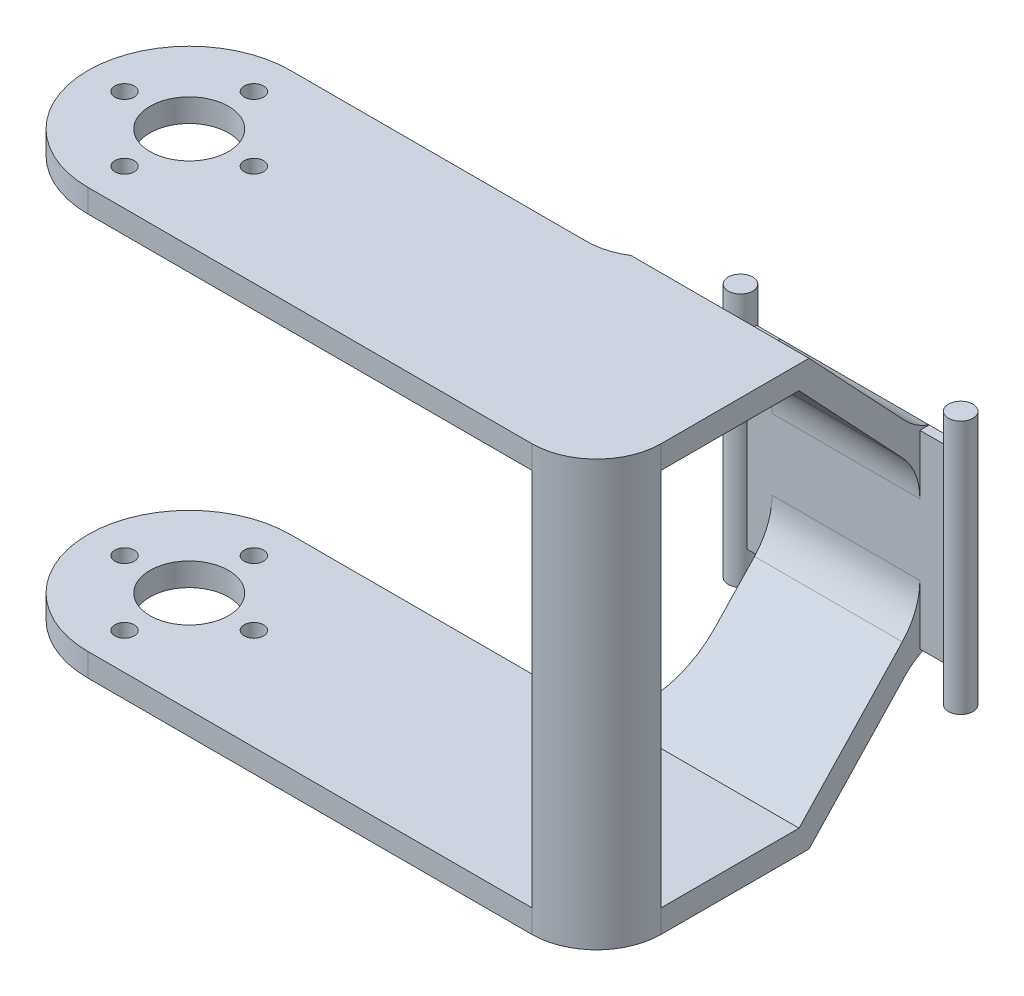
from build123d import *

# Parameters (mm, degrees)
SKETCH1_W           = 23.83
SKETCH1_H           = 1
BOSS_EXTRUDE1_DEPTH = 20.5
SKETCH2_R           = 1.325
BOSS_EXTRUDE2_DEPTH = 13.75
BOSS_EXTRUDE4_DEPTH = 8
SKETCH5_W           = 21.919818374
SKETCH5_H           = 2.5
BOSS_EXTRUDE5_DEPTH = 50
SKETCH6_R           = 4.25
SKETCH6_R_2         = 1.05
CUT_EXTRUDE1_DEPTH  = 83.099025573
FILLET1_R           = 7
FILLET2_R           = 7
FILLET3_R           = 7
BOSS_EXTRUDE6_START = 41
BOSS_EXTRUDE6_DEPTH = 41


with BuildPart() as part:
    # Sketch1 → Boss-Extrude1 (new body)
    with BuildSketch(Plane(origin=(0, 0, 0), x_dir=(1, 0, 0), z_dir=(0, 1, 0))):
        Rectangle(SKETCH1_W, SKETCH1_H)
    extrude(amount=BOSS_EXTRUDE1_DEPTH)

    # Sketch2 → Boss-Extrude2 (add, symmetric)
    with BuildSketch(Plane(origin=(0, 10.25, 0), x_dir=(1, 0, 0), z_dir=(0, 1, 0))):
        with Locations(Location((-11.915, 0, 0), (0, 0, 270))):
            Circle(SKETCH2_R)
        with Locations(Location((11.915, 0, 0), (0, 0, 270))):
            Circle(SKETCH2_R)
    extrude(amount=BOSS_EXTRUDE2_DEPTH, both=True)

    # Sketch4 → Boss-Extrude4 (add, symmetric)
    with BuildSketch(Plane(origin=(0, 0, 0), x_dir=(0, 0, -1), z_dir=(1, 0, 0))):
        Polygon((-0.5, 16.852307022), (-0.5, 20.5), (-12.5, 33.25), (-35.5, 33.25), (-35.5, 30.75), (-13.580181626, 30.75), align=None)
        Polygon((-0.5, 0), (-0.5, 3.647692978), (-13.580181626, -10.25), (-35.5, -10.25), (-35.5, -12.75), (-12.5, -12.75), align=None)
    extrude(amount=BOSS_EXTRUDE4_DEPTH, both=True)

    # Sketch5 → Boss-Extrude5 (add)
    with BuildSketch(Plane.ZY.offset(8)):
        with Locations((24.540090813, 32)):
            Rectangle(SKETCH5_W, SKETCH5_H)
        with Locations((24.540090813, -11.5)):
            Rectangle(SKETCH5_W, SKETCH5_H)
    extrude(amount=BOSS_EXTRUDE5_DEPTH)

    # Sketch6 → Cut-Extrude1 (cut, through all)
    with BuildSketch(Plane(origin=(0, 33.25, 0), x_dir=(1, 0, 0), z_dir=(0, 1, 0))):
        with Locations(Location((-47.040090813, -24.540090813, 0), (0, 0, 270))):
            Circle(SKETCH6_R)
        with Locations(Location((-54.040090813, -24.540090813, 0), (0, 0, 270))):
            Circle(SKETCH6_R_2)
        with Locations(Location((-47.040090813, -17.540090813, 0), (0, 0, 270))):
            Circle(SKETCH6_R_2)
        with Locations(Location((-40.040090813, -24.540090813, 0), (0, 0, 270))):
            Circle(SKETCH6_R_2)
        with Locations(Location((-47.040090813, -31.540090813, 0), (0, 0, 270))):
            Circle(SKETCH6_R_2)
        with BuildLine():
            ThreePointArc((-58, -24.540090813), (-54.78991692, -16.790264706), (-47.040090813, -13.580181626))
            Line((-47.040090813, -13.580181626), (-58, -13.580181626))
            Line((-58, -13.580181626), (-58, -24.540090813))
        make_face()
        with BuildLine():
            ThreePointArc((-47.040090813, -35.5), (-54.78991692, -32.28991692), (-58, -24.540090813))
            Line((-58, -24.540090813), (-58, -35.5))
            Line((-58, -35.5), (-47.040090813, -35.5))
        make_face()
    extrude(amount=-CUT_EXTRUDE1_DEPTH, mode=Mode.SUBTRACT)

    # Fillet1
    # the kernel refuses this fillet: 7 mm, written as the material it adds along each edge
    with BuildSketch(Plane(origin=(-8, -12.75, 13.580181626), x_dir=(-1, 0, 0), z_dir=(0, 1, 0))) as fillet1_piece_1_section:
        with BuildLine():
            CenterArc((FILLET1_R, -FILLET1_R), FILLET1_R, 90, 90)
            Line((0, -FILLET1_R), (0, 0))
            Line((0, 0), (FILLET1_R, 0))
        make_face()
    fillet1_piece_1 = extrude(amount=2.5, mode=Mode.PRIVATE)
    fillet1_piece_1 = split(fillet1_piece_1, bisect_by=Plane(origin=(-10.020174451, -12.153760937, 11.938833823), z_dir=(0, 0.6853646990049913, 0.7281999926928027)), keep=Keep.TOP, mode=Mode.PRIVATE)
    fillet1_piece_1 = split(fillet1_piece_1, bisect_by=Plane(origin=(-10.020174451, -10.440349189, 13.759333804), z_dir=(0, -0.685364699004991, -0.7281999926928029)), keep=Keep.TOP, mode=Mode.PRIVATE)
    add(fillet1_piece_1)
    with BuildSketch(Plane(origin=(-8, -12.75, 13.580181626), x_dir=(-1, 0, 0), z_dir=(0, 1, 0))) as fillet1_piece_2_section:
        with BuildLine():
            CenterArc((FILLET1_R, -FILLET1_R), FILLET1_R, 90, 90)
            Line((0, -FILLET1_R), (0, 0))
            Line((0, 0), (FILLET1_R, 0))
        make_face()
    fillet1_piece_2 = extrude(amount=20, mode=Mode.PRIVATE)
    fillet1_piece_2 = split(fillet1_piece_2, bisect_by=Plane(origin=(-8.816209607, -9.698679662, 9.628169093), z_dir=(0, 0.6853646990049913, 0.7281999926928027)), keep=Keep.TOP, mode=Mode.PRIVATE)
    fillet1_piece_2 = split(fillet1_piece_2, bisect_by=Plane(origin=(-8.816209607, -10.25, 10.809130305), z_dir=(0, 1, 0)), keep=Keep.TOP, mode=Mode.PRIVATE)
    fillet1_piece_2 = split(fillet1_piece_2, bisect_by=Plane(origin=(-8.816209607, -7.985267914, 11.448669075), z_dir=(0, -0.685364699004991, -0.7281999926928029)), keep=Keep.TOP, mode=Mode.PRIVATE)
    add(fillet1_piece_2)
    with BuildSketch(Plane(origin=(-8, 33.25, 13.580181626), x_dir=(0, 0, -1), z_dir=(0, -1, 0))) as fillet1_piece_3_section:
        with BuildLine():
            CenterArc((FILLET1_R, -FILLET1_R), FILLET1_R, 90, 90)
            Line((0, -FILLET1_R), (0, 0))
            Line((0, 0), (FILLET1_R, 0))
        make_face()
    fillet1_piece_3 = extrude(amount=2.5, mode=Mode.PRIVATE)
    fillet1_piece_3 = split(fillet1_piece_3, bisect_by=Plane(origin=(-10.020174451, 32.653760936, 11.938833823), z_dir=(0, -0.6853646990049912, 0.7281999926928028)), keep=Keep.TOP, mode=Mode.PRIVATE)
    fillet1_piece_3 = split(fillet1_piece_3, bisect_by=Plane(origin=(-10.020174451, 30.940349189, 13.759333804), z_dir=(0, 0.6853646990049909, -0.7281999926928031)), keep=Keep.TOP, mode=Mode.PRIVATE)
    add(fillet1_piece_3)
    with BuildSketch(Plane(origin=(-8, 33.25, 13.580181626), x_dir=(0, 0, -1), z_dir=(0, -1, 0))) as fillet1_piece_4_section:
        with BuildLine():
            CenterArc((FILLET1_R, -FILLET1_R), FILLET1_R, 90, 90)
            Line((0, -FILLET1_R), (0, 0))
            Line((0, 0), (FILLET1_R, 0))
        make_face()
    fillet1_piece_4 = extrude(amount=20, mode=Mode.PRIVATE)
    fillet1_piece_4 = split(fillet1_piece_4, bisect_by=Plane(origin=(-8.816209616, 30.198679665, 9.628169097), z_dir=(0, -0.6853646990049912, 0.7281999926928028)), keep=Keep.TOP, mode=Mode.PRIVATE)
    fillet1_piece_4 = split(fillet1_piece_4, bisect_by=Plane(origin=(-8.816209616, 28.485267918, 11.448669078), z_dir=(0, 0.6853646990049909, -0.7281999926928031)), keep=Keep.TOP, mode=Mode.PRIVATE)
    fillet1_piece_4 = split(fillet1_piece_4, bisect_by=Plane(origin=(-8.816209616, 30.75, 10.809130308), z_dir=(0, -1, 0)), keep=Keep.TOP, mode=Mode.PRIVATE)
    add(fillet1_piece_4)
    # the kernel refuses this fillet: 7 mm, written as the material it takes off along each edge
    with BuildSketch(Plane(origin=(8, 7.25, 35.5), x_dir=(0, 0, -1), z_dir=(0, -1, 0))) as fillet1_2_piece_1:
        with BuildLine():
            CenterArc((FILLET1_R, -FILLET1_R), FILLET1_R, 90, 90)
            Line((0, -FILLET1_R), (0, 0))
            Line((0, 0), (FILLET1_R, 0))
        make_face()
    extrude(amount=37.5, mode=Mode.SUBTRACT)
    with BuildSketch(Plane(origin=(8, 50.75, 35.5), x_dir=(-1, 0, 0), z_dir=(0, -1, 0))) as fillet1_2_piece_2:
        with BuildLine():
            CenterArc((FILLET1_R, FILLET1_R), FILLET1_R, 180, 90)
            Line((0, FILLET1_R), (0, 0))
            Line((0, 0), (FILLET1_R, 0))
        make_face()
    extrude(amount=37.5, mode=Mode.SUBTRACT)

    # Fillet2
    fillet2_edges = [part.edges().sort_by_distance(p)[0] for p in [
        (0, 16.852307022, 0.5),
        (0, 3.647692978, 0.5),
    ]]
    fillet(fillet2_edges, radius=FILLET2_R)

    # Fillet3
    # the kernel refuses this fillet: 7 mm, written as the material it adds along each edge
    with BuildSketch(Plane(origin=(-8, 20.5, 0.5), x_dir=(0, 0.7281999926925888, 0.6853646990052185), z_dir=(1, 0, 0))) as fillet3_piece_1:
        with BuildLine():
            CenterArc((2.423417163, -7), FILLET3_R, 90, 26.366519243)
            Line((-0.685364699, -0.728199993), (0, 0))
            Line((0, 0), (2.423417163, 0))
        make_face()
    extrude(amount=16)
    with BuildSketch(Plane(origin=(8, 0, 0.5), x_dir=(0, 0, -1), z_dir=(-1, 0, 0))) as fillet3_piece_2:
        with BuildLine():
            CenterArc((3.436475374, 6.562285254), FILLET3_R, 223.264295411, 26.366519243)
            Line((-1.660924575, 1.764732361), (0, 0))
            Line((0, 0), (1, 0))
        make_face()
    extrude(amount=16)

    # Sketch8 → Boss-Extrude6 (add)
    with BuildSketch(Plane(origin=(0, -10.25, 0), x_dir=(1, 0, 0), z_dir=(0, 1, 0)).offset(BOSS_EXTRUDE6_START)):
        with BuildLine():
            ThreePointArc((1, -35.5), (5.949747468, -33.449747468), (8, -28.5))
            Line((8, -28.5), (5, -28.5))
            ThreePointArc((5, -28.5), (3.422054899, -30.922054899), (1, -32.5))
            Line((1, -32.5), (1, -35.5))
        make_face()
    extrude(amount=-BOSS_EXTRUDE6_DEPTH)


solid = part.part
